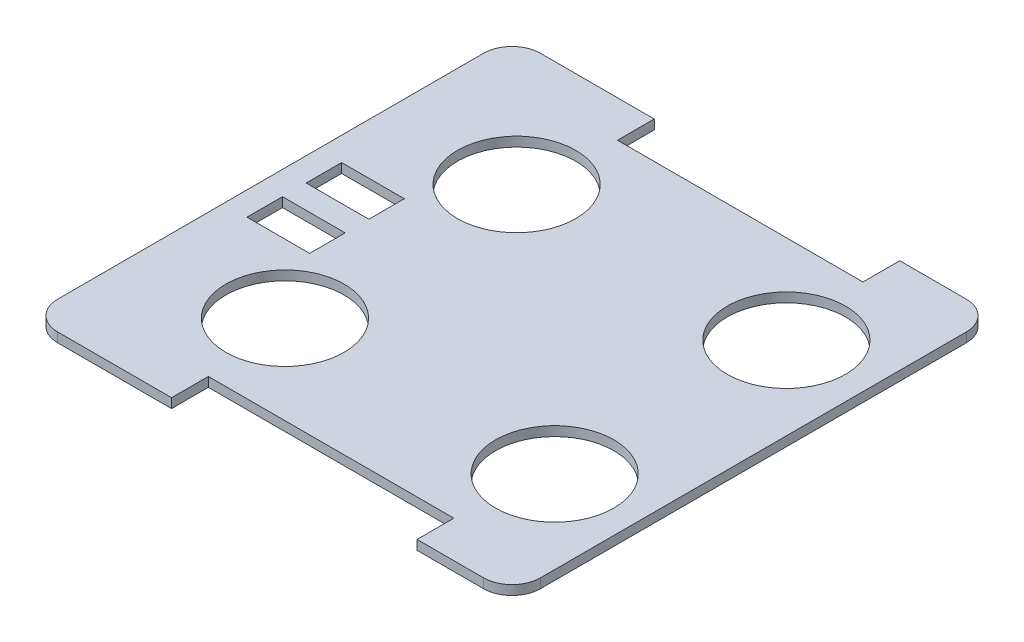
from build123d import *

# Parameters (mm, degrees)
SALIENTE_EXTRUIR1_DEPTH = 4
CORTAR_EXTRUIR1_REACH   = 536.422
CROQUIS2_R              = 50
CROQUIS2_W              = 53
CROQUIS2_H              = 30


with BuildPart() as part:
    # Croquis1 → Saliente-Extruir1 (new, symmetric)
    with BuildSketch(Plane(origin=(0, 54.707138557, 0), x_dir=(1, 0, 0), z_dir=(0, 1, 0))):
        with BuildLine():
            Line((-135.857036721, -92.1), (71.652963279, -92.1))
            Line((71.652963279, -92.1), (71.652963279, -61.00446543))
            Line((71.652963279, -61.00446543), (127.897963279, -61.00446543))
            ThreePointArc((127.897963279, -61.00446543), (144.865368491, -68.032594788), (151.893497848, -85))
            Line((151.893497848, -85), (151.893497848, -445))
            ThreePointArc((151.893497848, -445), (144.865368491, -461.967405212), (127.897963279, -468.99553457))
            Line((127.897963279, -468.99553457), (71.652963279, -468.99553457))
            Line((71.652963279, -468.99553457), (71.652963279, -437.9))
            Line((71.652963279, -437.9), (-135.857036721, -437.9))
            Line((-135.857036721, -437.9), (-135.857036721, -468.99553457))
            Line((-135.857036721, -468.99553457), (-232.102036721, -468.99553457))
            ThreePointArc((-232.102036721, -468.99553457), (-249.069441934, -461.967405212), (-256.097571291, -445))
            Line((-256.097571291, -445), (-256.097571291, -85))
            ThreePointArc((-256.097571291, -85), (-249.069441934, -68.032594788), (-232.102036721, -61.00446543))
            Line((-232.102036721, -61.00446543), (-135.857036721, -61.00446543))
            Line((-135.857036721, -61.00446543), (-135.857036721, -92.1))
        make_face()
    extrude(amount=SALIENTE_EXTRUIR1_DEPTH, both=True)

    # Croquis2 → Cortar-Extruir1 (cut, up to next)
    with BuildSketch(Plane(origin=(0, 58.707138557, 0), x_dir=(1, 0, 0), z_dir=(0, 1, 0)), mode=Mode.PRIVATE) as cortar_extruir1_sk1:
        with Locations((-146.097571291, -167.1)):
            Circle(CROQUIS2_R)
    cortar_extruir1_tool1 = extrude(cortar_extruir1_sk1.sketch, amount=-CORTAR_EXTRUIR1_REACH, mode=Mode.PRIVATE) & part.part
    # Croquis2 → Cortar-Extruir1 (cut, up to next)
    with BuildSketch(Plane(origin=(0, 58.707138557, 0), x_dir=(1, 0, 0), z_dir=(0, 1, 0)), mode=Mode.PRIVATE) as cortar_extruir1_sk2:
        with Locations((81.893497848, -167.1)):
            Circle(CROQUIS2_R)
    cortar_extruir1_tool2 = extrude(cortar_extruir1_sk2.sketch, amount=-CORTAR_EXTRUIR1_REACH, mode=Mode.PRIVATE) & part.part
    # Croquis2 → Cortar-Extruir1 (cut, up to next)
    with BuildSketch(Plane(origin=(0, 58.707138557, 0), x_dir=(1, 0, 0), z_dir=(0, 1, 0)), mode=Mode.PRIVATE) as cortar_extruir1_sk3:
        with Locations((81.893497848, -362.9)):
            Circle(CROQUIS2_R)
    cortar_extruir1_tool3 = extrude(cortar_extruir1_sk3.sketch, amount=-CORTAR_EXTRUIR1_REACH, mode=Mode.PRIVATE) & part.part
    # Croquis2 → Cortar-Extruir1 (cut, up to next)
    with BuildSketch(Plane(origin=(0, 58.707138557, 0), x_dir=(1, 0, 0), z_dir=(0, 1, 0)), mode=Mode.PRIVATE) as cortar_extruir1_sk4:
        with Locations((-146.097571291, -362.9)):
            Circle(CROQUIS2_R)
    cortar_extruir1_tool4 = extrude(cortar_extruir1_sk4.sketch, amount=-CORTAR_EXTRUIR1_REACH, mode=Mode.PRIVATE) & part.part
    # Croquis2 → Cortar-Extruir1 (cut, up to next)
    with BuildSketch(Plane(origin=(0, 58.707138557, 0), x_dir=(1, 0, 0), z_dir=(0, 1, 0)), mode=Mode.PRIVATE) as cortar_extruir1_sk5:
        with Locations((-209.597571291, -290)):
            Rectangle(CROQUIS2_W, CROQUIS2_H)
    cortar_extruir1_tool5 = extrude(cortar_extruir1_sk5.sketch, amount=-CORTAR_EXTRUIR1_REACH, mode=Mode.PRIVATE) & part.part
    # Croquis2 → Cortar-Extruir1 (cut, up to next)
    with BuildSketch(Plane(origin=(0, 58.707138557, 0), x_dir=(1, 0, 0), z_dir=(0, 1, 0)), mode=Mode.PRIVATE) as cortar_extruir1_sk6:
        with Locations((-209.597571291, -240)):
            Rectangle(CROQUIS2_W, CROQUIS2_H)
    cortar_extruir1_tool6 = extrude(cortar_extruir1_sk6.sketch, amount=-CORTAR_EXTRUIR1_REACH, mode=Mode.PRIVATE) & part.part
    add(cortar_extruir1_tool1.solids().sort_by_distance((-146.097571, 58.707139, 167.1))[0], mode=Mode.SUBTRACT)
    add(cortar_extruir1_tool2.solids().sort_by_distance((81.893498, 58.707139, 167.1))[0], mode=Mode.SUBTRACT)
    add(cortar_extruir1_tool3.solids().sort_by_distance((81.893498, 58.707139, 362.9))[0], mode=Mode.SUBTRACT)
    add(cortar_extruir1_tool4.solids().sort_by_distance((-146.097571, 58.707139, 362.9))[0], mode=Mode.SUBTRACT)
    add(cortar_extruir1_tool5.solids().sort_by_distance((-209.597571, 58.707139, 290))[0], mode=Mode.SUBTRACT)
    add(cortar_extruir1_tool6.solids().sort_by_distance((-209.597571, 58.707139, 240))[0], mode=Mode.SUBTRACT)


solid = part.part
